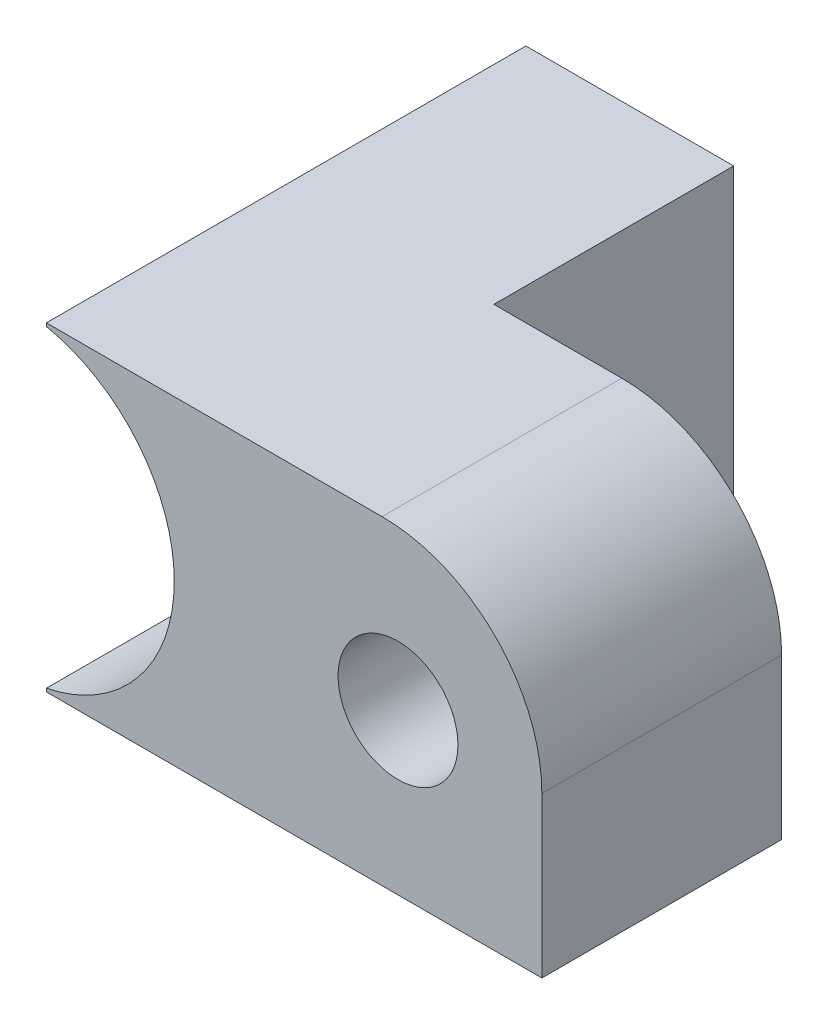
from build123d import *

# Parameters (mm, degrees)
BOSS_EXTRUDE1_DEPTH          = 38.1
CUT_EXTRUDE1_DEPTH           = 19.05
F_3_8_0_375_DIAMETER_HOLE1_D = 9.525
CHAMFER1_SIZE                = 1.27


with BuildPart() as part:
    # Sketch1 → Boss-Extrude1 (new body)
    with BuildSketch(Plane.XY):
        with BuildLine():
            Line((2.54, 0), (41.91, 0))
            Line((41.91, 0), (41.91, 12.7))
            ThreePointArc((41.91, 12.7), (38.190256121, 21.680256121), (29.21, 25.4))
            Line((29.21, 25.4), (2.54, 25.4))
            Line((2.54, 25.4), (2.54, 25.143407893))
            ThreePointArc((2.54, 25.143407893), (12.7, 12.7), (2.54, 0.256592107))
            Line((2.54, 0.256592107), (2.54, 0))
        make_face()
    extrude(amount=BOSS_EXTRUDE1_DEPTH)

    # Sketch2 → Cut-Extrude1 (cut)
    with BuildSketch(Plane(origin=(0, 0, 0), x_dir=(-1, 0, 0), z_dir=(0, 0, -1))):
        with BuildLine():
            Line((-19.05, 0), (-19.05, 25.4))
            Line((-19.05, 25.4), (-29.21, 25.4))
            ThreePointArc((-29.21, 25.4), (-38.190256121, 21.680256121), (-41.91, 12.7))
            Line((-41.91, 12.7), (-41.91, 0))
            Line((-41.91, 0), (-19.05, 0))
        make_face()
    extrude(amount=-CUT_EXTRUDE1_DEPTH, mode=Mode.SUBTRACT)

    # 3/8 (0.375) Diameter Hole1 (through all)
    with Locations(Plane.XY.offset(38.1)):
        with Locations((30.48, 12.7)):
            Hole(F_3_8_0_375_DIAMETER_HOLE1_D / 2)

    # Chamfer1
    chamfer1_edges = [part.edges().sort_by_distance(p)[0] for p in [
        (19.05, 0, 9.525),
    ]]
    chamfer(chamfer1_edges, length=CHAMFER1_SIZE)


solid = part.part
